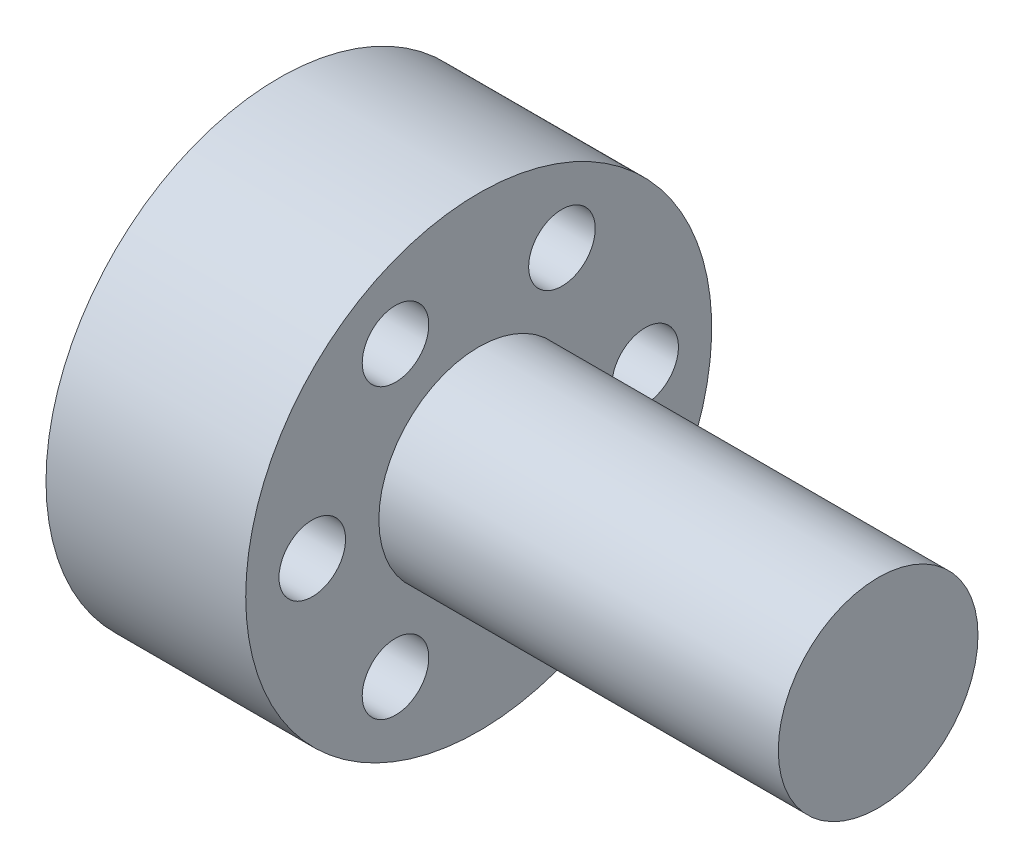
from build123d import *

# Parameters (mm, degrees)
SKETCH_2_R          = 4.25
CUT_EXTRUDE_1_DEPTH = 20
THREAD_1_PITCH      = 1.5
SKETCH_5_R          = 5
CUT_EXTRUDE_2_DEPTH = 112.579568022
SKETCH_6_R          = 5
CUT_EXTRUDE_3_DEPTH = 112.579568022
SKETCH_7_R          = 5
CUT_EXTRUDE_4_DEPTH = 112.579568022
SKETCH_8_R          = 5
CUT_EXTRUDE_5_DEPTH = 112.579568022
SKETCH_9_R          = 5
CUT_EXTRUDE_6_DEPTH = 112.579568022
SKETCH_10_R         = 5
CUT_EXTRUDE_7_DEPTH = 112.579568022


with BuildPart() as part:
    # Sketch 1 → Повернуть1 (revolve)
    with BuildSketch(Plane.XY, mode=Mode.PRIVATE) as revolve_1_sk:
        Polygon((0, 0), (100, 0), (100, 15), (40, 15), (40, 35), (10, 35), (10, 20), (0, 20), align=None)
    revolve(revolve_1_sk.sketch.rotate(Axis((0, 0, 0), (1, 0, 0)), 90), axis=Axis((0, 0, 0), (1, 0, 0)))

    # Эскиз2 → Вырез-Вытянуть1 (cut)
    with BuildSketch(Plane(origin=(0, 0, 0), x_dir=(0, 0, -1), z_dir=(1, 0, 0))):
        Circle(SKETCH_2_R)
    extrude(amount=CUT_EXTRUDE_1_DEPTH, mode=Mode.SUBTRACT)

    # Резьба1: the profile of Sketch 1 2 profile screwed along a right-hand helix of 13.333333 turns, 8 arcs to a turn; built about Z, then put on its axis
    thread_1_z = Axis((0, 0, 0), (0, 0, 1))
    thread_1_corners = [(4.2497, 0, -0.000173205), (5.061898812, 0, 0.468749998), (5.061898812, 0, 0.656249998), (4.2497, 0, 1.125173201)]
    with BuildLine(mode=Mode.PRIVATE) as thread_1_profile:
        Line(thread_1_corners[0], thread_1_corners[1])
        Line(thread_1_corners[1], thread_1_corners[2])
        Line(thread_1_corners[2], thread_1_corners[3])
        Line(thread_1_corners[3], thread_1_corners[0])
    thread_1_cap = Face(thread_1_profile.wire())
    thread_1_turn_angles = [0, 22.5, 45, 67.5, 90, 112.5, 135, 157.5, 180, 202.5, 225, 247.5, 270, 292.5, 315, 337.5, 360]
    thread_1_turn_weights = [1, 0.9238795325112867, 1, 0.9238795325112867, 1, 0.9238795325112867, 1, 0.9238795325112867, 1, 0.9238795325112867, 1, 0.9238795325112867, 1, 0.9238795325112867, 1, 0.9238795325112867, 1]
    thread_1_turn_rails = [Edge.make_bspline([Vector(p[0], p[1], 0).rotate(thread_1_z, thread_1_turn_angles[k]) / thread_1_turn_weights[k] + Vector(0, 0, p[2] + THREAD_1_PITCH * thread_1_turn_angles[k] / 360) for k in range(17)], [0, 0, 0, 1, 1, 2, 2, 3, 3, 4, 4, 5, 5, 6, 6, 7, 7, 8, 8, 8], 2, thread_1_turn_weights) for p in thread_1_corners]
    thread_1_turn_sides = [Face.make_surface_from_curves(thread_1_turn_rails[p[0]], thread_1_turn_rails[p[1]]) for p in [(0, 1), (1, 2), (2, 3), (3, 0)]]
    thread_1_last_angles = [4680, 4702.5, 4725, 4747.5, 4770, 4785, 4800]
    thread_1_last_weights = [1, 0.9238795325112867, 1, 0.9238795325112867, 1, 0.9659258262890703, 1]
    thread_1_last_rails = [Edge.make_bspline([Vector(p[0], p[1], 0).rotate(thread_1_z, thread_1_last_angles[k]) / thread_1_last_weights[k] + Vector(0, 0, p[2] + THREAD_1_PITCH * thread_1_last_angles[k] / 360) for k in range(7)], [0, 0, 0, 1, 1, 2, 2, 3, 3, 3], 2, thread_1_last_weights) for p in thread_1_corners]
    thread_1_last_sides = [Face.make_surface_from_curves(thread_1_last_rails[p[0]], thread_1_last_rails[p[1]]) for p in [(0, 1), (1, 2), (2, 3), (3, 0)]]
    thread_1 = Plane(origin=(0, 0, 0), x_dir=(0, 0, -1), z_dir=(1, 0, 0)) * Solid(Shell([*[p.moved(Location((0, 0, THREAD_1_PITCH * i))) for i in range(13) for p in thread_1_turn_sides], *thread_1_last_sides, thread_1_cap, thread_1_cap.rotate(thread_1_z, 4800).moved(Location((0, 0, THREAD_1_PITCH * 4800 / 360)))]))
    add(thread_1, mode=Mode.SUBTRACT)

    # Эскиз5 → Вырез-Вытянуть2 (cut, through all)
    with BuildSketch(Plane(origin=(0, 0, 0), x_dir=(0, 0, -1), z_dir=(1, 0, 0))):
        with Locations(Location((25, 0, 0), (0, 0, 180))):
            Circle(SKETCH_5_R)
    extrude(amount=CUT_EXTRUDE_2_DEPTH, mode=Mode.SUBTRACT)

    # Эскиз6 → Вырез-Вытянуть3 (cut, through all)
    with BuildSketch(Plane(origin=(0, 0, 0), x_dir=(0, 0, -1), z_dir=(1, 0, 0))):
        with Locations(Location((12.5, 21.650635095, 0), (0, 0, 180))):
            Circle(SKETCH_6_R)
    extrude(amount=CUT_EXTRUDE_3_DEPTH, mode=Mode.SUBTRACT)

    # Эскиз7 → Вырез-Вытянуть4 (cut, through all)
    with BuildSketch(Plane(origin=(0, 0, 0), x_dir=(0, 0, -1), z_dir=(1, 0, 0))):
        with Locations(Location((-12.5, 21.650635095, 0), (0, 0, 180))):
            Circle(SKETCH_7_R)
    extrude(amount=CUT_EXTRUDE_4_DEPTH, mode=Mode.SUBTRACT)

    # Эскиз8 → Вырез-Вытянуть5 (cut, through all)
    with BuildSketch(Plane(origin=(0, 0, 0), x_dir=(0, 0, -1), z_dir=(1, 0, 0))):
        with Locations(Location((-25, 0, 0), (0, 0, 180))):
            Circle(SKETCH_8_R)
    extrude(amount=CUT_EXTRUDE_5_DEPTH, mode=Mode.SUBTRACT)

    # Эскиз9 → Вырез-Вытянуть6 (cut, through all)
    with BuildSketch(Plane(origin=(0, 0, 0), x_dir=(0, 0, -1), z_dir=(1, 0, 0))):
        with Locations(Location((-12.5, -21.650635095, 0), (0, 0, 180))):
            Circle(SKETCH_9_R)
    extrude(amount=CUT_EXTRUDE_6_DEPTH, mode=Mode.SUBTRACT)

    # Эскиз10 → Вырез-Вытянуть7 (cut, through all)
    with BuildSketch(Plane(origin=(0, 0, 0), x_dir=(0, 0, -1), z_dir=(1, 0, 0))):
        with Locations(Location((12.5, -21.650635095, 0), (0, 0, 180))):
            Circle(SKETCH_10_R)
    extrude(amount=CUT_EXTRUDE_7_DEPTH, mode=Mode.SUBTRACT)


solid = part.part
